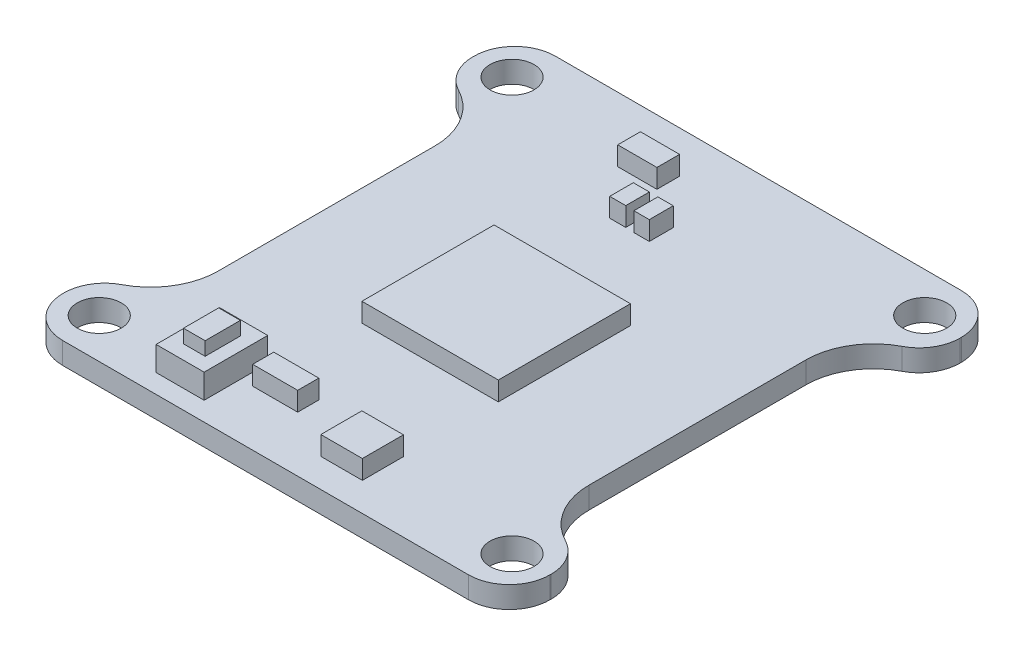
from build123d import *

# Parameters (mm, degrees)
SKETCH1_R             = 1.625
PCB_DEPTH             = 1.6
SKETCH2_W             = 10.080807645
SKETCH2_H             = 9.766872459
SKETCH2_W_2           = 3.069588487
SKETCH2_H_2           = 3.0347068
SKETCH2_W_3           = 2.89518005
SKETCH2_H_3           = 1.674320993
SKETCH2_W_4           = 1.18597737
SKETCH2_H_4           = 1.744084367
SKETCH2_W_5           = 1.137538121
SKETCH2_H_5           = 1.77179178
SKETCH2_W_6           = 3.325937142
SKETCH2_H_6           = 1.560165557
TOP_COMPONENTS_DEPTH  = 1.4
FILLET1_R             = 3
FILLET2_R             = 5
SKETCH3_W             = 3.174233549
SKETCH3_H             = 2.964943425
SKETCH3_W_2           = 3.104470174
SKETCH3_H_2           = 1.534794244
SKETCH3_W_3           = 2.999825112
SKETCH3_H_3           = 1.569675931
SKETCH3_W_4           = 1.255740744
SKETCH3_H_4           = 2.895180051
SKETCH3_W_5           = 1.151095683
SKETCH3_H_5           = 2.058019554
REAR_COMPONENTS_DEPTH = 1.4
SKETCH4_W             = 3.55
SKETCH4_H             = 4.7
BUTTON_BASE_DEPTH     = 1.8
SKETCH5_W             = 1.6
SKETCH5_H             = 2.6
BUTTON_TIP_DEPTH      = 1


with BuildPart() as part:
    # Sketch1 → PCB (new body)
    with BuildSketch(Plane(origin=(0, 0, 0), x_dir=(1, 0, 0), z_dir=(0, 1, 0))):
        Polygon((-18, 18.2), (-18, 12.1), (-13.7, 12.1), (-13.7, -12.1), (-18, -12.1), (-18, -18.2), (18, -18.2), (18, -12.1), (13.7, -12.1), (13.7, 12.1), (18, 12.1), (18, 18.2), align=None)
        with Locations((-15.25, 15.25)):
            Circle(SKETCH1_R, mode=Mode.SUBTRACT)
        with Locations((15.25, 15.25)):
            Circle(SKETCH1_R, mode=Mode.SUBTRACT)
        with Locations((15.25, -15.25)):
            Circle(SKETCH1_R, mode=Mode.SUBTRACT)
        with Locations((-15.25, -15.25)):
            Circle(SKETCH1_R, mode=Mode.SUBTRACT)
    extrude(amount=PCB_DEPTH)

    # Sketch2 → Top components (add)
    with BuildSketch(Plane(origin=(0, 1.6, 0), x_dir=(1, 0, 0), z_dir=(0, 1, 0))):
        with Locations((-0.017440844, -1.151095683)):
            Rectangle(SKETCH2_W, SKETCH2_H)
        with Locations((3.488168735, -14.56310447)):
            Rectangle(SKETCH2_W_2, SKETCH2_H_2)
        with Locations((-4.168361639, 14.266610128)):
            Rectangle(SKETCH2_W_3, SKETCH2_H_3)
        with Locations((-2.023137867, 10.708678018)):
            Rectangle(SKETCH2_W_4, SKETCH2_H_4)
        with Locations((-0.233509749, 10.694824311)):
            Rectangle(SKETCH2_W_5, SKETCH2_H_5)
        with Locations((-3.394876095, -13.324858297)):
            Rectangle(SKETCH2_W_6, SKETCH2_H_6)
    extrude(amount=TOP_COMPONENTS_DEPTH)

    # Fillet1
    fillet1_edges = [part.edges().sort_by_distance(p)[0] for p in [
        (-18, 0.8, 12.1),
        (-18, 0.8, -12.1),
        (18, 0.8, -12.1),
        (18, 0.8, 12.1),
        (18, 0.8, 18.2),
        (-18, 0.8, 18.2),
        (-18, 0.8, -18.2),
        (18, 0.8, -18.2),
    ]]
    fillet(fillet1_edges, radius=FILLET1_R)

    # Fillet2
    fillet2_edges = [part.edges().sort_by_distance(p)[0] for p in [
        (13.7, 0.8, -12.1),
        (13.7, 0.8, 12.1),
        (-13.7, 0.8, 12.1),
        (-13.7, 0.8, -12.1),
    ]]
    fillet(fillet2_edges, radius=FILLET2_R)

    # Sketch3 → Rear components (add)
    with BuildSketch(Plane.XZ):
        with Locations((-8.319282433, -14.318932658)):
            Rectangle(SKETCH3_W, SKETCH3_H)
        with Locations((-4.307888388, -14.127083378)):
            Rectangle(SKETCH3_W_2, SKETCH3_H_2)
        with Locations((3.662577172, 9.540141492)):
            Rectangle(SKETCH3_W_3, SKETCH3_H_3)
        with Locations((-4.150920795, 9.470378117)):
            Rectangle(SKETCH3_W_4, SKETCH3_H_4)
        with Locations((-1.552235088, -14.388696033)):
            Rectangle(SKETCH3_W_5, SKETCH3_H_5)
    extrude(amount=REAR_COMPONENTS_DEPTH)

    # Sketch4 → Button base (add)
    with BuildSketch(Plane(origin=(0, 1.6, 0), x_dir=(1, 0, 0), z_dir=(0, 1, 0))):
        with Locations((-7.725, -14.45)):
            Rectangle(SKETCH4_W, SKETCH4_H)
    extrude(amount=BUTTON_BASE_DEPTH)

    # Sketch5 → Button tip (add)
    with BuildSketch(Plane(origin=(0, 3.4, 0), x_dir=(1, 0, 0), z_dir=(0, 1, 0))):
        with Locations((-7.725, -14.45)):
            Rectangle(SKETCH5_W, SKETCH5_H)
    extrude(amount=BUTTON_TIP_DEPTH)


solid = part.part
